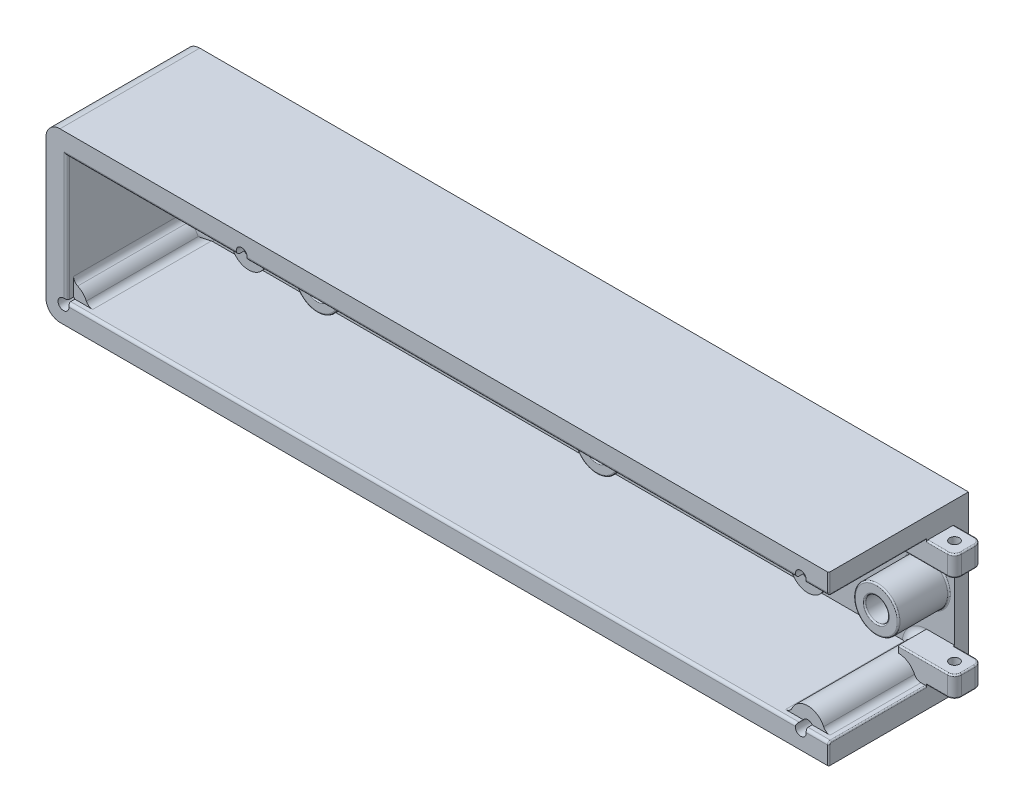
from build123d import *

# Parameters (mm, degrees)
SKETCH1_W            = 840
SKETCH1_H            = 140
SKETCH1_R            = 4.15
BOSS_EXTRUDE1_DEPTH  = 5
SKETCH2_R            = 8
SKETCH2_R_2          = 4.15
BOSS_EXTRUDE3_DEPTH  = 18
LPATTERN1_COUNT      = 7
LPATTERN1_PITCH      = 100
SKETCH4_W            = 45.610881299
SKETCH4_H            = 87.937650726
BOSS_EXTRUDE4_DEPTH  = 1
SKETCH5_W            = 840
SKETCH5_H            = 5
CUT_EXTRUDE1_DEPTH   = 40
SKETCH6_W            = 720
SKETCH6_H            = 40
CUT_EXTRUDE2_DEPTH   = 427.173673518
FILLET1_R            = 5
FILLET2_R            = 0.5
FILLET3_R            = 1
BOSS_EXTRUDE5_DEPTH  = 45
FILLET4_R            = 1
SKETCH10_W           = 7.375
SKETCH10_H           = 85.25
CUT_EXTRUDE3_DEPTH   = 45
FILLET5_R            = 1
SKETCH11_R           = 4.15
BOSS_EXTRUDE6_DEPTH  = 5
CUT_EXTRUDE4_DEPTH   = 20
SKETCH13_W           = 12
SKETCH13_H           = 12
CUT_EXTRUDE5_DEPTH   = 5
CUT_EXTRUDE6_REACH   = 1266.951
SKETCH14_W           = 9
SKETCH14_H           = 16
SKETCH20_R           = 1.95
CUT_EXTRUDE8_DEPTH   = 26
BOSS_EXTRUDE8_REACH  = 1264.837
SKETCH22_R           = 6.25
SKETCH22_R_2         = 1.95
BOSS_EXTRUDE9_DEPTH  = 19
FILLET6_R            = 2.5
CUT_EXTRUDE10_START  = -540
SKETCH25_W           = 118.103244202
SKETCH25_H           = 133.878018472
CUT_EXTRUDE10_DEPTH  = 540
BOSS_EXTRUDE10_DEPTH = 10
SKETCH27_W           = 9.875
SKETCH27_H           = 7.41
BOSS_EXTRUDE11_DEPTH = 10
FILLET7_R            = 2.5
FILLET8_R            = 0.5
FILLET7_OF_MIRROR2_R = 2.5
FILLET8_OF_MIRROR2_R = 0.5
SKETCH28_R           = 1.75
CUT_EXTRUDE11_DEPTH  = 1263.080349308


with BuildPart() as part:
    # Sketch1 → Boss-Extrude1 (new body)
    with BuildSketch(Plane.XY):
        Rectangle(SKETCH1_W, SKETCH1_H)
        with Locations((-350, 0)):
            Circle(SKETCH1_R, mode=Mode.SUBTRACT)
        with Locations((-250, 0)):
            Circle(SKETCH1_R, mode=Mode.SUBTRACT)
        with Locations((-150, 0)):
            Circle(SKETCH1_R, mode=Mode.SUBTRACT)
        with Locations((-50, 0)):
            Circle(SKETCH1_R, mode=Mode.SUBTRACT)
        with Locations((50, 0)):
            Circle(SKETCH1_R, mode=Mode.SUBTRACT)
        with Locations((150, 0)):
            Circle(SKETCH1_R, mode=Mode.SUBTRACT)
        with Locations((250, 0)):
            Circle(SKETCH1_R, mode=Mode.SUBTRACT)
        with BuildLine():
            Line((333.7, -57.5), (333.7, 17.5))
            ThreePointArc((333.7, 17.5), (334.520101013, 19.479898987), (336.5, 20.3))
            Line((336.5, 20.3), (363.5, 20.3))
            ThreePointArc((363.5, 20.3), (365.479898987, 19.479898987), (366.3, 17.5))
            Line((366.3, 17.5), (366.3, -57.5))
            ThreePointArc((366.3, -57.5), (365.479898987, -59.479898987), (363.5, -60.3))
            Line((363.5, -60.3), (336.5, -60.3))
            ThreePointArc((336.5, -60.3), (334.520101013, -59.479898987), (333.7, -57.5))
        make_face(mode=Mode.SUBTRACT)
    extrude(amount=BOSS_EXTRUDE1_DEPTH)

    # Sketch2 → Boss-Extrude3 (add)
    with BuildSketch(Plane.XY.offset(5)):
        with Locations(Location((-350, 0, 0), (0, 0, 180))):
            Circle(SKETCH2_R)
        with Locations((-350, 0)):
            Circle(SKETCH2_R_2, mode=Mode.SUBTRACT)
    boss_extrude3 = extrude(amount=BOSS_EXTRUDE3_DEPTH)

    # LPattern1: Boss-Extrude3 ×7
    with Locations(*[(i * LPATTERN1_PITCH, 0, 0) for i in range(1, LPATTERN1_COUNT)]):
        add(boss_extrude3)

    # Sketch4 → Boss-Extrude4 (add)
    with BuildSketch(Plane(origin=(0, 0, 0), x_dir=(-1, 0, 0), z_dir=(0, 0, -1))):
        with Locations((-349.932526386, -19.852361379)):
            Rectangle(SKETCH4_W, SKETCH4_H)
    extrude(amount=-BOSS_EXTRUDE4_DEPTH)

    # Sketch5 → Cut-Extrude1 (cut)
    with BuildSketch(Plane(origin=(0, 70, 0), x_dir=(1, 0, 0), z_dir=(0, 1, 0))):
        with Locations((0, -2.5)):
            Rectangle(SKETCH5_W, SKETCH5_H)
    extrude(amount=-CUT_EXTRUDE1_DEPTH, mode=Mode.SUBTRACT)

    # Sketch6 → Cut-Extrude2 (cut, through all)
    with BuildSketch(Plane.XY.offset(5)):
        with Locations((-60, -50)):
            Rectangle(SKETCH6_W, SKETCH6_H)
    extrude(amount=-CUT_EXTRUDE2_DEPTH, mode=Mode.SUBTRACT)

    # Fillet1
    fillet1_edges = [part.edges().sort_by_distance(p)[0] for p in [
        (-420, 30, 2.5),
        (-420, -30, 2.5),
        (300, -30, 2.5),
        (300, -70, 2.5),
    ]]
    fillet(fillet1_edges, radius=FILLET1_R)

    # Fillet2
    fillet2_edges = [part.edges().sort_by_distance(p)[0] for p in [
        (334.520101013, -59.479898987, 5),
        (350, -60.3, 5),
        (365.479898987, -59.479898987, 5),
        (366.3, -20, 5),
        (365.479898987, 19.479898987, 5),
        (350, 20.3, 5),
        (334.520101013, 19.479898987, 5),
        (333.7, -20, 5),
        (-342, 0, 5),
        (-342, 0, 23),
        (-354.15, 0, 23),
        (258, 0, 5),
        (158, 0, 5),
        (58, 0, 5),
        (-42, 0, 5),
        (-142, 0, 5),
        (-242, 0, 5),
        (-242, 0, 23),
        (-254.15, 0, 23),
        (-142, 0, 23),
        (-154.15, 0, 23),
        (-42, 0, 23),
        (-54.15, 0, 23),
        (58, 0, 23),
        (45.85, 0, 23),
        (158, 0, 23),
        (145.85, 0, 23),
        (258, 0, 23),
        (245.85, 0, 23),
    ]]
    fillet(fillet2_edges, radius=FILLET2_R)

    # Fillet3
    fillet3_edges = [part.edges().sort_by_distance(p)[0] for p in [
        (333.7, -20, 1),
        (350, -60.3, 1),
        (334.520101013, -59.479898987, 1),
        (334.520101013, 19.479898987, 1),
        (350, 20.3, 1),
        (365.479898987, 19.479898987, 1),
        (366.3, -20, 1),
        (365.479898987, -59.479898987, 1),
    ]]
    fillet(fillet3_edges, radius=FILLET3_R)

    # Sketch8 → Boss-Extrude5 (add)
    with BuildSketch(Plane.XY.offset(5)):
        with BuildLine():
            Line((300, -35), (300, -65))
            ThreePointArc((300, -65), (301.464466094, -68.535533906), (305, -70))
            Line((305, -70), (420, -70))
            Line((420, -70), (420, 30))
            Line((420, 30), (-415, 30))
            ThreePointArc((-415, 30), (-418.535533906, 28.535533906), (-420, 25))
            Line((-420, 25), (-420, -25))
            ThreePointArc((-420, -25), (-418.535533906, -28.535533906), (-415, -30))
            Line((-415, -30), (295, -30))
            ThreePointArc((295, -30), (298.535533906, -31.464466094), (300, -35))
        make_face()
        with BuildLine():
            Line((412.625, -62.625), (412.625, 22.625))
            Line((412.625, 22.625), (-412.625, 22.625))
            Line((-412.625, 22.625), (-412.625, -22.625))
            Line((-412.625, -22.625), (295, -22.625))
            ThreePointArc((295, -22.625), (303.750446417, -26.249553583), (307.375, -35))
            Line((307.375, -35), (307.375, -62.625))
            Line((307.375, -62.625), (412.625, -62.625))
        make_face(mode=Mode.SUBTRACT)
    extrude(amount=BOSS_EXTRUDE5_DEPTH)

    # Fillet4
    fillet4_edges = [part.edges().sort_by_distance(p)[0] for p in [
        (-58.8125, -22.625, 50),
        (303.750446417, -26.249553583, 50),
        (307.375, -48.8125, 50),
    ]]
    fillet(fillet4_edges, radius=FILLET4_R)

    # Sketch10 → Cut-Extrude3 (cut)
    with BuildSketch(Plane.XY.offset(50)):
        with Locations((416.3125, -20)):
            Rectangle(SKETCH10_W, SKETCH10_H)
    extrude(amount=-CUT_EXTRUDE3_DEPTH, mode=Mode.SUBTRACT)

    # Fillet5
    fillet5_edges = [part.edges().sort_by_distance(p)[0] for p in [
        (-412.625, -0.5, 50),
        (3.6875, 22.625, 50),
        (363.1875, -62.625, 50),
    ]]
    fillet(fillet5_edges, radius=FILLET5_R)

    # Sketch11 → Boss-Extrude6 (add)
    with BuildSketch(Plane(origin=(0, 0, 0), x_dir=(-1, 0, 0), z_dir=(0, 0, -1))):
        with Locations((-250, 0)):
            Circle(SKETCH11_R)
        with Locations((-150, 0)):
            Circle(SKETCH11_R)
        with Locations((-50, 0)):
            Circle(SKETCH11_R)
        with Locations((50, 0)):
            Circle(SKETCH11_R)
        with Locations((150, 0)):
            Circle(SKETCH11_R)
        with Locations((250, 0)):
            Circle(SKETCH11_R)
        with Locations((350, 0)):
            Circle(SKETCH11_R)
    extrude(amount=-BOSS_EXTRUDE6_DEPTH)


with BuildPart() as body_2:
    # Mirror1: mirrored copy
    add(part.part.mirror(Plane(origin=(420, -70, 5), x_dir=(0, 0, 1), z_dir=(-1, 0, 0))))

    # Sketch12 → Cut-Extrude4 (cut)
    with BuildSketch(Plane.ZY.offset(-420)):
        with BuildLine():
            Line((50, 23.625), (50, 30))
            Line((50, 30), (0, 30))
            Line((0, 30), (0, -70))
            Line((0, -70), (50, -70))
            Line((50, -70), (50, -63.625))
            ThreePointArc((50, -63.625), (49.707106781, -62.917893219), (49, -62.625))
            Line((49, -62.625), (5, -62.625))
            Line((5, -62.625), (5, 22.625))
            Line((5, 22.625), (49, 22.625))
            ThreePointArc((49, 22.625), (49.707106781, 22.917893219), (50, 23.625))
        make_face()
    extrude(amount=-CUT_EXTRUDE4_DEPTH, mode=Mode.SUBTRACT)

    # Sketch13 → Cut-Extrude5 (cut)
    with BuildSketch(Plane.XZ.offset(70)):
        with Locations((461, 29)):
            Rectangle(SKETCH13_W, SKETCH13_H)
    extrude(amount=-CUT_EXTRUDE5_DEPTH, mode=Mode.SUBTRACT)

    # Sketch14 → Cut-Extrude6 (cut, up to next)
    with BuildSketch(Plane.XZ.offset(70), mode=Mode.PRIVATE) as cut_extrude6_sk1:
        with Locations((461, 29)):
            Rectangle(SKETCH14_W, SKETCH14_H)
    cut_extrude6_tool1 = extrude(cut_extrude6_sk1.sketch, amount=-CUT_EXTRUDE6_REACH, mode=Mode.PRIVATE) & body_2.part
    add(cut_extrude6_tool1.solids().sort_by_distance((461, -70, 29))[0], mode=Mode.SUBTRACT)

    # Sketch20 → Cut-Extrude8 (cut)
    with BuildSketch(Plane.XY.offset(50)):
        with Locations((790, 23.75)):
            Circle(SKETCH20_R)
        with Locations((790, -23.75)):
            Circle(SKETCH20_R)
        with Locations((460, 23.75)):
            Circle(SKETCH20_R)
        with Locations((533.75, -63.75)):
            Circle(SKETCH20_R)
        with Locations((690, 23.75)):
            Circle(SKETCH20_R)
        with Locations((890, -23.75)):
            Circle(SKETCH20_R)
        with Locations((990, 23.75)):
            Circle(SKETCH20_R)
        with Locations((690, -23.75)):
            Circle(SKETCH20_R)
        with Locations((890, 23.75)):
            Circle(SKETCH20_R)
        with Locations((990, -23.75)):
            Circle(SKETCH20_R)
        with Locations((1190, 23.75)):
            Circle(SKETCH20_R)
        with Locations((1253.75, -23.75)):
            Circle(SKETCH20_R)
    extrude(amount=-CUT_EXTRUDE8_DEPTH, mode=Mode.SUBTRACT)

    # Sketch22 → Boss-Extrude8 (add, up to next)
    with BuildSketch(Plane.XY.offset(47.5), mode=Mode.PRIVATE) as boss_extrude8_sk1:
        with Locations((460, 23.75)):
            Circle(SKETCH22_R)
        with Locations(Location((460, 23.75, 0), (0, 0, 324.765582015))):
            Circle(SKETCH22_R_2, mode=Mode.SUBTRACT)
    boss_extrude8_tool1 = extrude(boss_extrude8_sk1.sketch, amount=-BOSS_EXTRUDE8_REACH, mode=Mode.PRIVATE) - body_2.part
    # Sketch22 → Boss-Extrude8 (add, up to next)
    with BuildSketch(Plane.XY.offset(47.5), mode=Mode.PRIVATE) as boss_extrude8_sk2:
        with Locations((690, 23.75)):
            Circle(SKETCH22_R)
        with Locations(Location((690, 23.75, 0), (0, 0, 324.765582015))):
            Circle(SKETCH22_R_2, mode=Mode.SUBTRACT)
    boss_extrude8_tool2 = extrude(boss_extrude8_sk2.sketch, amount=-BOSS_EXTRUDE8_REACH, mode=Mode.PRIVATE) - body_2.part
    # Sketch22 → Boss-Extrude8 (add, up to next)
    with BuildSketch(Plane.XY.offset(47.5), mode=Mode.PRIVATE) as boss_extrude8_sk3:
        with Locations((790, 23.75)):
            Circle(SKETCH22_R)
        with Locations(Location((790, 23.75, 0), (0, 0, 324.765582015))):
            Circle(SKETCH22_R_2, mode=Mode.SUBTRACT)
    boss_extrude8_tool3 = extrude(boss_extrude8_sk3.sketch, amount=-BOSS_EXTRUDE8_REACH, mode=Mode.PRIVATE) - body_2.part
    # Sketch22 → Boss-Extrude8 (add, up to next)
    with BuildSketch(Plane.XY.offset(47.5), mode=Mode.PRIVATE) as boss_extrude8_sk4:
        with Locations((890, 23.75)):
            Circle(SKETCH22_R)
        with Locations(Location((890, 23.75, 0), (0, 0, 324.765582015))):
            Circle(SKETCH22_R_2, mode=Mode.SUBTRACT)
    boss_extrude8_tool4 = extrude(boss_extrude8_sk4.sketch, amount=-BOSS_EXTRUDE8_REACH, mode=Mode.PRIVATE) - body_2.part
    # Sketch22 → Boss-Extrude8 (add, up to next)
    with BuildSketch(Plane.XY.offset(47.5), mode=Mode.PRIVATE) as boss_extrude8_sk5:
        with Locations((990, 23.75)):
            Circle(SKETCH22_R)
        with Locations(Location((990, 23.75, 0), (0, 0, 324.765582015))):
            Circle(SKETCH22_R_2, mode=Mode.SUBTRACT)
    boss_extrude8_tool5 = extrude(boss_extrude8_sk5.sketch, amount=-BOSS_EXTRUDE8_REACH, mode=Mode.PRIVATE) - body_2.part
    # Sketch22 → Boss-Extrude8 (add, up to next)
    with BuildSketch(Plane.XY.offset(47.5), mode=Mode.PRIVATE) as boss_extrude8_sk6:
        with Locations((1190, 23.75)):
            Circle(SKETCH22_R)
        with Locations(Location((1190, 23.75, 0), (0, 0, 324.765582015))):
            Circle(SKETCH22_R_2, mode=Mode.SUBTRACT)
    boss_extrude8_tool6 = extrude(boss_extrude8_sk6.sketch, amount=-BOSS_EXTRUDE8_REACH, mode=Mode.PRIVATE) - body_2.part
    # Sketch22 → Boss-Extrude8 (add, up to next)
    with BuildSketch(Plane.XY.offset(47.5), mode=Mode.PRIVATE) as boss_extrude8_sk7:
        with Locations((1253.75, -23.75)):
            Circle(SKETCH22_R)
        with Locations(Location((1253.75, -23.75, 0), (0, 0, 125.234417985))):
            Circle(SKETCH22_R_2, mode=Mode.SUBTRACT)
    boss_extrude8_tool7 = extrude(boss_extrude8_sk7.sketch, amount=-BOSS_EXTRUDE8_REACH, mode=Mode.PRIVATE) - body_2.part
    # Sketch22 → Boss-Extrude8 (add, up to next)
    with BuildSketch(Plane.XY.offset(47.5), mode=Mode.PRIVATE) as boss_extrude8_sk8:
        with Locations((990, -23.75)):
            Circle(SKETCH22_R)
        with Locations(Location((990, -23.75, 0), (0, 0, 35.234417985))):
            Circle(SKETCH22_R_2, mode=Mode.SUBTRACT)
    boss_extrude8_tool8 = extrude(boss_extrude8_sk8.sketch, amount=-BOSS_EXTRUDE8_REACH, mode=Mode.PRIVATE) - body_2.part
    # Sketch22 → Boss-Extrude8 (add, up to next)
    with BuildSketch(Plane.XY.offset(47.5), mode=Mode.PRIVATE) as boss_extrude8_sk9:
        with Locations((890, -23.75)):
            Circle(SKETCH22_R)
        with Locations(Location((890, -23.75, 0), (0, 0, 35.234417985))):
            Circle(SKETCH22_R_2, mode=Mode.SUBTRACT)
    boss_extrude8_tool9 = extrude(boss_extrude8_sk9.sketch, amount=-BOSS_EXTRUDE8_REACH, mode=Mode.PRIVATE) - body_2.part
    # Sketch22 → Boss-Extrude8 (add, up to next)
    with BuildSketch(Plane.XY.offset(47.5), mode=Mode.PRIVATE) as boss_extrude8_sk10:
        with Locations((790, -23.75)):
            Circle(SKETCH22_R)
        with Locations(Location((790, -23.75, 0), (0, 0, 35.234417985))):
            Circle(SKETCH22_R_2, mode=Mode.SUBTRACT)
    boss_extrude8_tool10 = extrude(boss_extrude8_sk10.sketch, amount=-BOSS_EXTRUDE8_REACH, mode=Mode.PRIVATE) - body_2.part
    # Sketch22 → Boss-Extrude8 (add, up to next)
    with BuildSketch(Plane.XY.offset(47.5), mode=Mode.PRIVATE) as boss_extrude8_sk11:
        with Locations((690, -23.75)):
            Circle(SKETCH22_R)
        with Locations(Location((690, -23.75, 0), (0, 0, 35.234417985))):
            Circle(SKETCH22_R_2, mode=Mode.SUBTRACT)
    boss_extrude8_tool11 = extrude(boss_extrude8_sk11.sketch, amount=-BOSS_EXTRUDE8_REACH, mode=Mode.PRIVATE) - body_2.part
    # Sketch22 → Boss-Extrude8 (add, up to next)
    with BuildSketch(Plane.XY.offset(47.5), mode=Mode.PRIVATE) as boss_extrude8_sk12:
        with Locations((533.75, -63.75)):
            Circle(SKETCH22_R)
        with Locations(Location((533.75, -63.75, 0), (0, 0, 125.234417985))):
            Circle(SKETCH22_R_2, mode=Mode.SUBTRACT)
    boss_extrude8_tool12 = extrude(boss_extrude8_sk12.sketch, amount=-BOSS_EXTRUDE8_REACH, mode=Mode.PRIVATE) - body_2.part
    add(boss_extrude8_tool1.solids().sort_by_distance((453.926777, 23.75, 47.5))[0])
    add(boss_extrude8_tool2.solids().sort_by_distance((683.926777, 23.75, 47.5))[0])
    add(boss_extrude8_tool3.solids().sort_by_distance((783.926777, 23.75, 47.5))[0])
    add(boss_extrude8_tool4.solids().sort_by_distance((883.926777, 23.75, 47.5))[0])
    add(boss_extrude8_tool5.solids().sort_by_distance((983.926777, 23.75, 47.5))[0])
    add(boss_extrude8_tool6.solids().sort_by_distance((1183.926777, 23.75, 47.5))[0])
    add(boss_extrude8_tool7.solids().sort_by_distance((1247.676777, -23.75, 47.5))[0])
    add(boss_extrude8_tool8.solids().sort_by_distance((983.926777, -23.75, 47.5))[0])
    add(boss_extrude8_tool9.solids().sort_by_distance((883.926777, -23.75, 47.5))[0])
    add(boss_extrude8_tool10.solids().sort_by_distance((783.926777, -23.75, 47.5))[0])
    add(boss_extrude8_tool11.solids().sort_by_distance((683.926777, -23.75, 47.5))[0])
    add(boss_extrude8_tool12.solids().sort_by_distance((527.676777, -63.75, 47.5))[0])

    # Sketch23 → Boss-Extrude9 (add)
    with BuildSketch(Plane.XY.offset(5)):
        with BuildLine():
            Line((461.592757044, 22.625), (458.407242956, 22.625))
            ThreePointArc((458.407242956, 22.625), (460, 21.8), (461.592757044, 22.625))
        make_face()
        with BuildLine():
            Line((691.592757044, 22.625), (688.407242956, 22.625))
            ThreePointArc((688.407242956, 22.625), (690, 21.8), (691.592757044, 22.625))
        make_face()
        with BuildLine():
            Line((791.592757044, 22.625), (788.407242956, 22.625))
            ThreePointArc((788.407242956, 22.625), (790, 21.8), (791.592757044, 22.625))
        make_face()
        with BuildLine():
            Line((891.592757044, 22.625), (888.407242956, 22.625))
            ThreePointArc((888.407242956, 22.625), (890, 21.8), (891.592757044, 22.625))
        make_face()
        with BuildLine():
            Line((991.592757044, 22.625), (988.407242956, 22.625))
            ThreePointArc((988.407242956, 22.625), (990, 21.8), (991.592757044, 22.625))
        make_face()
        with BuildLine():
            Line((1191.592757044, 22.625), (1188.407242956, 22.625))
            ThreePointArc((1188.407242956, 22.625), (1190, 21.8), (1191.592757044, 22.625))
        make_face()
        with BuildLine():
            Line((1252.157242956, -22.625), (1252.625, -22.625))
            Line((1252.625, -22.625), (1252.625, -22.157242956))
            ThreePointArc((1252.625, -22.157242956), (1252.371141777, -22.371141777), (1252.157242956, -22.625))
        make_face()
        with BuildLine():
            Line((988.407242956, -22.625), (991.592757044, -22.625))
            ThreePointArc((991.592757044, -22.625), (990, -21.8), (988.407242956, -22.625))
        make_face()
        with BuildLine():
            Line((888.407242956, -22.625), (891.592757044, -22.625))
            ThreePointArc((891.592757044, -22.625), (890, -21.8), (888.407242956, -22.625))
        make_face()
        with BuildLine():
            Line((788.407242956, -22.625), (791.592757044, -22.625))
            ThreePointArc((791.592757044, -22.625), (790, -21.8), (788.407242956, -22.625))
        make_face()
        with BuildLine():
            Line((688.407242956, -22.625), (691.592757044, -22.625))
            ThreePointArc((691.592757044, -22.625), (690, -21.8), (688.407242956, -22.625))
        make_face()
        with BuildLine():
            Line((532.157242956, -62.625), (532.625, -62.625))
            Line((532.625, -62.625), (532.625, -62.157242956))
            ThreePointArc((532.625, -62.157242956), (532.371141777, -62.371141777), (532.157242956, -62.625))
        make_face()
    extrude(amount=BOSS_EXTRUDE9_DEPTH)

    # Fillet6
    fillet6_edges = [body_2.edges().sort_by_distance(p)[0] for p in [
        (890, 17.5, 5),
        (990, 17.5, 5),
        (1190, 17.5, 5),
        (1252.625, -17.602083686, 26.25),
        (1249.330582618, -19.330582618, 5),
        (990, -17.5, 5),
        (890, -17.5, 5),
        (532.625, -57.602083686, 26.25),
        (896.147916314, -22.625, 26.25),
        (883.852083686, -22.625, 26.25),
        (996.147916314, -22.625, 26.25),
        (983.852083686, -22.625, 26.25),
        (1247.602083686, -22.625, 26.25),
        (796.147916314, -22.625, 26.25),
        (783.852083686, -22.625, 26.25),
        (696.147916314, -22.625, 26.25),
        (683.852083686, -22.625, 26.25),
        (1183.852083686, 22.625, 26.25),
        (1196.147916314, 22.625, 26.25),
        (983.852083686, 22.625, 26.25),
        (996.147916314, 22.625, 26.25),
        (883.852083686, 22.625, 26.25),
        (896.147916314, 22.625, 26.25),
        (783.852083686, 22.625, 26.25),
        (796.147916314, 22.625, 26.25),
        (683.852083686, 22.625, 26.25),
        (696.147916314, 22.625, 26.25),
        (453.852083686, 22.625, 26.25),
        (466.147916314, 22.625, 26.25),
        (460, 17.5, 5),
        (529.330582618, -59.330582618, 5),
        (527.602083686, -62.625, 26.25),
        (690, -17.5, 5),
        (790, -17.5, 5),
        (690, 17.5, 5),
        (790, 17.5, 5),
    ]]
    fillet(fillet6_edges, radius=FILLET6_R)

    # Sketch25 → Cut-Extrude10 (cut)
    with BuildSketch(Plane.ZY.offset(-440).offset(CUT_EXTRUDE10_START)):
        with Locations((24.273530132, -25.707977532)):
            Rectangle(SKETCH25_W, SKETCH25_H)
    extrude(amount=CUT_EXTRUDE10_DEPTH, mode=Mode.SUBTRACT)

    # Sketch26 → Boss-Extrude10 (add)
    with BuildSketch(Plane.XY.offset(5)):
        with BuildLine():
            Line((990, 15), (980, 15))
            Line((980, 15), (980, 22.625))
            Line((980, 22.625), (988.407242956, 22.625))
            ThreePointArc((988.407242956, 22.625), (989.103130444, 22.018490543), (990, 21.8))
            Line((990, 21.8), (990, 15))
        make_face()
    boss_extrude10 = extrude(amount=BOSS_EXTRUDE10_DEPTH)

    # Sketch27 → Boss-Extrude11 (add)
    with BuildSketch(Plane.ZY.offset(-980)):
        with Locations((10.0625, 18.705)):
            Rectangle(SKETCH27_W, SKETCH27_H)
    boss_extrude11 = extrude(amount=BOSS_EXTRUDE11_DEPTH)

    # Fillet7
    fillet7_edges = [body_2.edges().sort_by_distance(p)[0] for p in [
        (970, 18.705, 15),
        (970, 18.705, 5.125),
    ]]
    fillet(fillet7_edges, radius=FILLET7_R)

    # Fillet8
    fillet8_edges = [body_2.edges().sort_by_distance(p)[0] for p in [
        (980, 26.8125, 50),
        (980, 22.917893219, 49.707106781),
        (980, 22.625, 32),
        (970, 22.41, 10.0625),
        (970, 15, 10.0625),
        (981.25, 15, 15),
        (976.25, 15, 5.125),
        (970.732233047, 15, 14.267766953),
        (970.732233047, 15, 5.857233047),
        (976.25, 22.41, 5.125),
        (976.25, 22.41, 15),
        (970.732233047, 22.41, 14.267766953),
        (970.732233047, 22.41, 5.857233047),
    ]]
    fillet(fillet8_edges, radius=FILLET8_R)

    # Mirror2: Boss-Extrude10, Boss-Extrude11 across plane
    add(boss_extrude10.mirror(Plane.ZX))
    add(boss_extrude11.mirror(Plane.ZX))

    # Fillet7 of Mirror2
    fillet7_of_mirror2_edges = [body_2.edges().sort_by_distance(p)[0] for p in [
        (970, -18.705, 15),
        (970, -18.705, 5.125),
    ]]
    fillet(fillet7_of_mirror2_edges, radius=FILLET7_OF_MIRROR2_R)

    # Fillet8 of Mirror2
    fillet8_of_mirror2_edges = [body_2.edges().sort_by_distance(p)[0] for p in [
        (980, -26.8125, 50),
        (980, -22.917893219, 49.707106781),
        (980, -22.625, 32),
        (970, -22.41, 10.0625),
        (970, -15, 10.0625),
        (981.25, -15, 15),
        (976.25, -15, 5.125),
        (970.732233047, -15, 14.267766953),
        (970.732233047, -15, 5.857233047),
        (976.25, -22.41, 5.125),
        (976.25, -22.41, 15),
        (970.732233047, -22.41, 14.267766953),
        (970.732233047, -22.41, 5.857233047),
    ]]
    fillet(fillet8_of_mirror2_edges, radius=FILLET8_OF_MIRROR2_R)

    # Sketch28 → Cut-Extrude11 (cut, through all)
    with BuildSketch(Plane.XZ.offset(22.41)):
        with Locations(Location((975, 10, 0), (0, 0, 270))):
            Circle(SKETCH28_R)
    extrude(amount=-CUT_EXTRUDE11_DEPTH, mode=Mode.SUBTRACT)


with BuildPart() as body_2_2:
    # Mirror3: mirrored copy
    add(body_2.part.mirror(Plane(origin=(1260, 0, 25), x_dir=(0, 0, 1), z_dir=(1, 0, 0))))


solid = body_2_2.part
